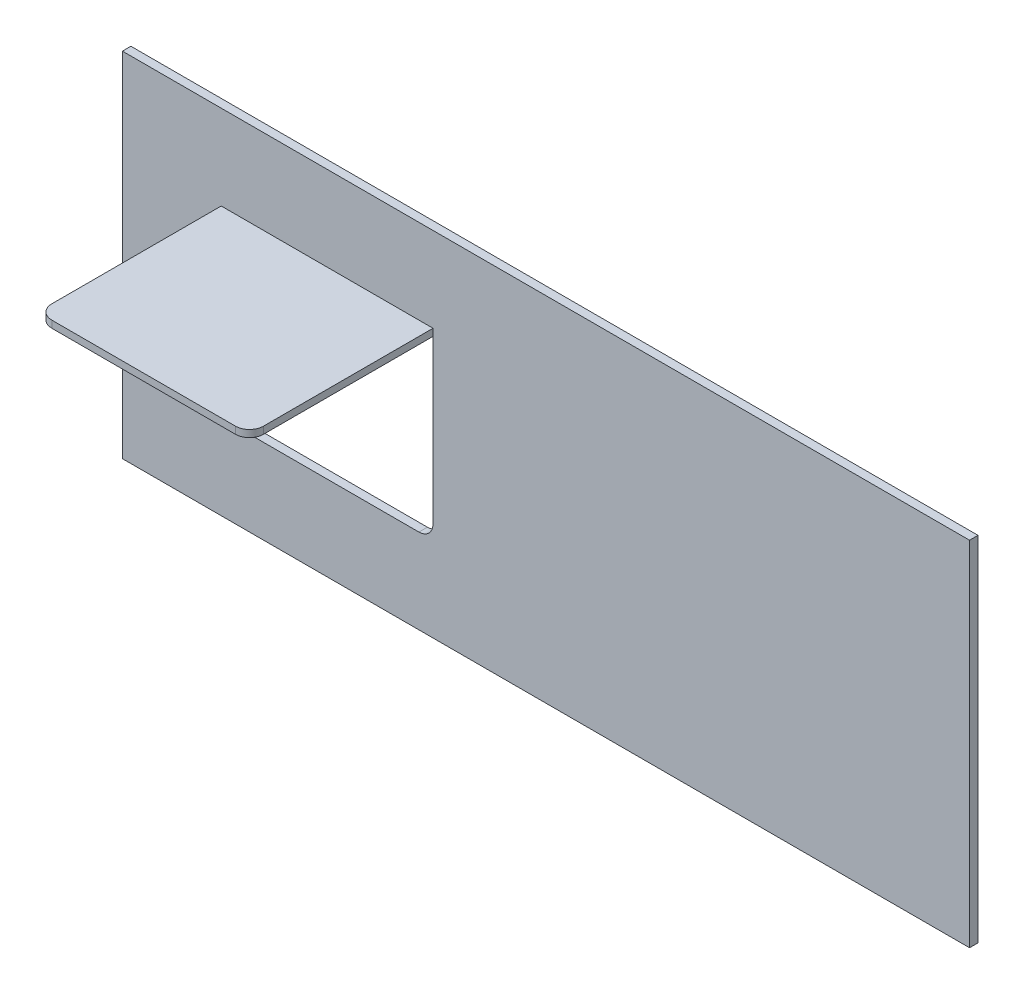
from build123d import *

# Parameters (mm, degrees)
ESBO_O1_W                = 600
ESBO_O1_H                = 250
RESSALTO_EXTRUS_O1_DEPTH = 6
ESBO_O7_W                = 150
ESBO_O7_H                = 130
CORTE_EXTRUS_O6_DEPTH    = 215
ESBO_O8_W                = 150
ESBO_O8_H                = 130
RESSALTO_EXTRUS_O2_DEPTH = 5
FILETE5_R                = 10
FILETE6_R                = 10
FILETE7_R                = 10
FILETE8_R                = 10


with BuildPart() as part:
    # Esboço1 → Ressalto-extrusão1 (new body)
    with BuildSketch(Plane.XY):
        with Locations((300, -125)):
            Rectangle(ESBO_O1_W, ESBO_O1_H)
    extrude(amount=RESSALTO_EXTRUS_O1_DEPTH)

    # Esboço7 → Corte-extrusão6 (cut)
    with BuildSketch(Plane.XY.offset(6)):
        with Locations((145, -125)):
            Rectangle(ESBO_O7_W, ESBO_O7_H)
    extrude(amount=-CORTE_EXTRUS_O6_DEPTH, mode=Mode.SUBTRACT)

    # Filete5
    filete5_edges = [part.edges().sort_by_distance(p)[0] for p in [
        (70, -190, 3),
    ]]
    fillet(filete5_edges, radius=FILETE5_R)

    # Filete6
    filete6_edges = [part.edges().sort_by_distance(p)[0] for p in [
        (220, -190, 3),
    ]]
    fillet(filete6_edges, radius=FILETE6_R)


with BuildPart() as body_2:
    # Esboço8 → Ressalto-extrusão2 (new body)
    with BuildSketch(Plane.XZ.offset(60)):
        with Locations((145, 71)):
            Rectangle(ESBO_O8_W, ESBO_O8_H)
    extrude(amount=RESSALTO_EXTRUS_O2_DEPTH)

    # Filete7
    filete7_edges = [body_2.edges().sort_by_distance(p)[0] for p in [
        (220, -62.5, 136),
    ]]
    fillet(filete7_edges, radius=FILETE7_R)

    # Filete8
    filete8_edges = [body_2.edges().sort_by_distance(p)[0] for p in [
        (70, -62.5, 136),
    ]]
    fillet(filete8_edges, radius=FILETE8_R)


solid = Compound([part.part, body_2.part])
